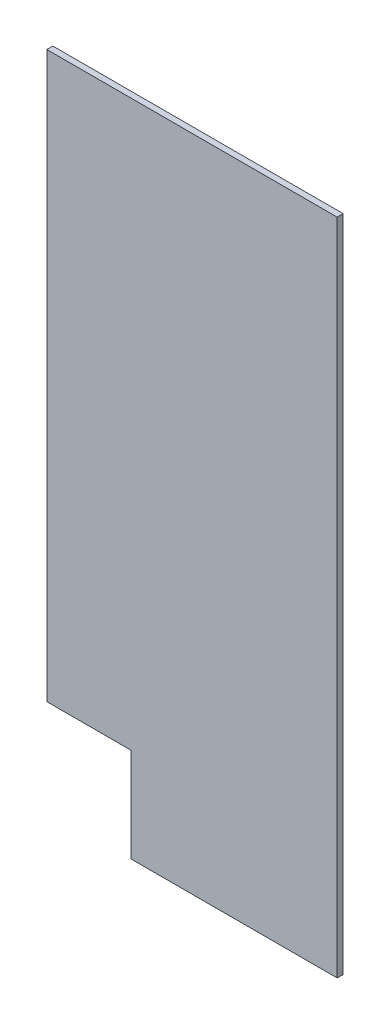
from build123d import *

# Parameters (mm, degrees)
ESQUISSE1_W             = 155
ESQUISSE1_H             = 329
BOSS_EXTRU_1_DEPTH      = 3
ENL_V_MAT_EXTRU_1_DEPTH = 10


with BuildPart() as part:
    # Esquisse1 → Boss.-Extru.1 (new body)
    with BuildSketch(Plane.XY):
        with Locations((39.953008068, 104.661286668)):
            Rectangle(ESQUISSE1_W, ESQUISSE1_H)
    extrude(amount=BOSS_EXTRU_1_DEPTH)

    # Esquisse2 → Enlèv. mat.-Extru.1 (cut)
    with BuildSketch(Plane.XY.offset(3)):
        Polygon((-27.546991932, -12.838713332), (-27.546991932, 269.161286668), (-37.546991932, 269.161286668), (-37.546991932, -12.838713332), (-37.546991932, -59.838713332), (14.453008068, -59.838713332), (14.453008068, -12.838713332), align=None)
    extrude(amount=-ENL_V_MAT_EXTRU_1_DEPTH, mode=Mode.SUBTRACT)


solid = part.part
